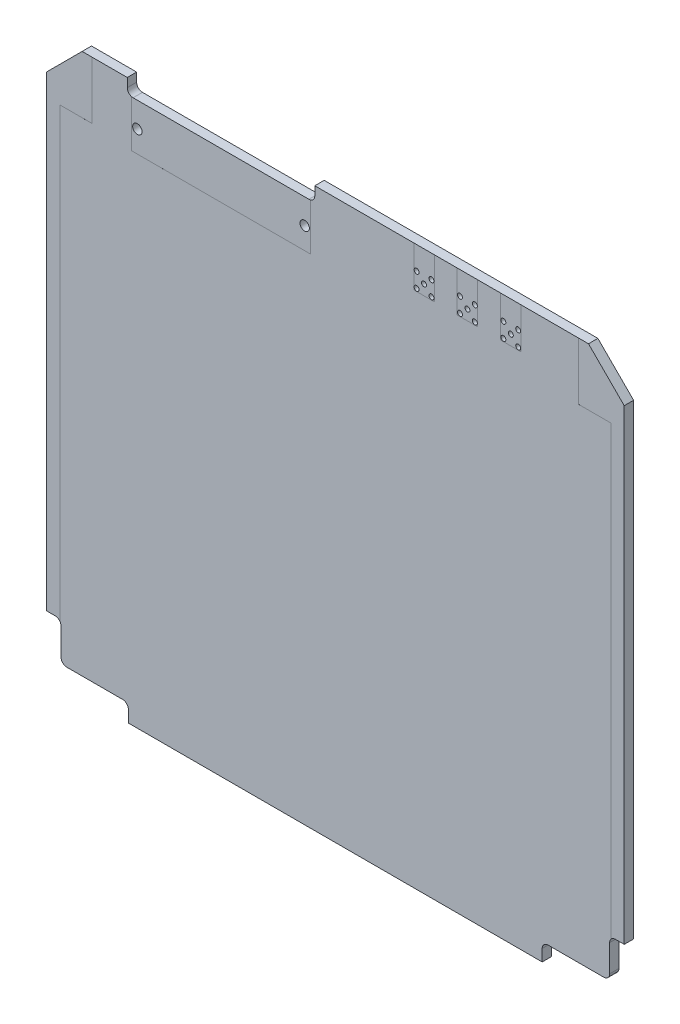
from build123d import *

# Parameters (mm, degrees)
SKETCH1_R           = 0.425
SKETCH1_R_2         = 0.8
BOSS_EXTRUDE1_DEPTH = 1.6
CUT_EXTRUDE1_DEPTH  = 0.0001
CUT_EXTRUDE2_DEPTH  = 0.0001
PARTFOOTPRINTS_W    = 30.48
PARTFOOTPRINTS_H    = 7.989227112
PARTFOOTPRINTS_W_2  = 3.5
PARTFOOTPRINTS_H_2  = 6.95
CUT_EXTRUDE3_DEPTH  = 0.0001


with BuildPart() as part:
    # Sketch1 → Boss-Extrude1 (new body)
    with BuildSketch(Plane(origin=(0, 0, -0.0125), x_dir=(-1, 0, 0), z_dir=(0, 0, -1))):
        with BuildLine():
            Line((35.3, -50), (35.3, -48))
            ThreePointArc((35.3, -48), (35.592893219, -47.292893219), (36.3, -47))
            Line((36.3, -47), (45.8, -47))
            ThreePointArc((45.8, -47), (46.507106781, -46.707106781), (46.8, -46))
            Line((46.8, -46), (46.8, -41.4))
            ThreePointArc((46.8, -41.4), (47.092893219, -40.692893219), (47.8, -40.4))
            Line((47.8, -40.4), (49.3, -40.4))
            Line((49.3, -40.4), (49.3, 39.2))
            Line((49.3, 39.2), (43.2, 45.3))
            Line((43.2, 45.3), (35.500000002, 45.3))
            Line((35.500000002, 45.3), (35.500000002, 43.8))
            ThreePointArc((35.500000002, 43.8), (35.207106783, 43.092893219), (34.500000002, 42.8))
            Line((34.500000002, 42.8), (4.499999998, 42.8))
            ThreePointArc((4.499999998, 42.8), (3.792893217, 43.092893219), (3.499999998, 43.8))
            Line((3.499999998, 43.8), (3.499999998, 45.3))
            Line((3.499999998, 45.3), (-43.2, 45.3))
            Line((-43.2, 45.3), (-49.3, 39.2))
            Line((-49.3, 39.2), (-49.3, -40.4))
            Line((-49.3, -40.4), (-47.8, -40.4))
            ThreePointArc((-47.8, -40.4), (-47.092893219, -40.692893219), (-46.8, -41.4))
            Line((-46.8, -41.4), (-46.8, -46))
            ThreePointArc((-46.8, -46), (-46.507106781, -46.707106781), (-45.8, -47))
            Line((-45.8, -47), (-36.3, -47))
            ThreePointArc((-36.3, -47), (-35.592893219, -47.292893219), (-35.3, -48))
            Line((-35.3, -48), (-35.3, -50))
            Line((-35.3, -50), (35.3, -50))
        make_face()
        with Locations((-21.27, 41.37)):
            Circle(SKETCH1_R, mode=Mode.SUBTRACT)
        with Locations((-23.81, 41.37)):
            Circle(SKETCH1_R, mode=Mode.SUBTRACT)
        with Locations((-22.54, 40.1)):
            Circle(SKETCH1_R, mode=Mode.SUBTRACT)
        with Locations((-13.87, 41.37)):
            Circle(SKETCH1_R, mode=Mode.SUBTRACT)
        with Locations((-23.81, 38.83)):
            Circle(SKETCH1_R, mode=Mode.SUBTRACT)
        with Locations((-16.41, 41.37)):
            Circle(SKETCH1_R, mode=Mode.SUBTRACT)
        with Locations((-15.14, 40.1)):
            Circle(SKETCH1_R, mode=Mode.SUBTRACT)
        with Locations((-21.27, 38.83)):
            Circle(SKETCH1_R, mode=Mode.SUBTRACT)
        with Locations((-28.67, 41.37)):
            Circle(SKETCH1_R, mode=Mode.SUBTRACT)
        with Locations((-31.21, 41.37)):
            Circle(SKETCH1_R, mode=Mode.SUBTRACT)
        with Locations((-16.41, 38.83)):
            Circle(SKETCH1_R, mode=Mode.SUBTRACT)
        with Locations((-29.94, 40.1)):
            Circle(SKETCH1_R, mode=Mode.SUBTRACT)
        with Locations((-31.21, 38.83)):
            Circle(SKETCH1_R, mode=Mode.SUBTRACT)
        with Locations((-28.67, 38.83)):
            Circle(SKETCH1_R, mode=Mode.SUBTRACT)
        with Locations((33.775, 38.54)):
            Circle(SKETCH1_R_2, mode=Mode.SUBTRACT)
        with Locations((5.225, 38.54)):
            Circle(SKETCH1_R_2, mode=Mode.SUBTRACT)
        with Locations((-13.87, 38.83)):
            Circle(SKETCH1_R, mode=Mode.SUBTRACT)
    extrude(amount=-BOSS_EXTRUDE1_DEPTH)

    # thermalContacts_lower → Cut-Extrude1 (cut)
    with BuildSketch(Plane(origin=(0, 0, -0.0125), x_dir=(-1, 0, 0), z_dir=(0, 0, -1))):
        Polygon((47, 35.5), (47, -41.5), (59.827263463, -41.5), (59.827263463, 47), (41.5, 47), (41.5, 41.5), (41.5, 35.5), align=None)
        Polygon((-47, 35.5), (-47, -41.5), (-56.192158269, -41.5), (-56.192158269, 47), (-41.5, 47), (-41.5, 41.5), (-41.5, 35.5), align=None)
    extrude(amount=-CUT_EXTRUDE1_DEPTH, mode=Mode.SUBTRACT)

    # thermalContacts_upper → Cut-Extrude2 (cut)
    with BuildSketch(Plane.XY.offset(1.5875)):
        Polygon((-47, 35.5), (-47, -41.5), (-56.192158269, -41.5), (-56.192158269, 47), (-41.5, 47), (-41.5, 41.5), (-41.5, 35.5), align=None)
        Polygon((47, 35.5), (47, -41.5), (59.827263463, -41.5), (59.827263463, 47), (41.5, 47), (41.5, 41.5), (41.5, 35.5), align=None)
    extrude(amount=-CUT_EXTRUDE2_DEPTH, mode=Mode.SUBTRACT)

    # partFootprints → Cut-Extrude3 (cut)
    with BuildSketch(Plane.XY.offset(1.5875)):
        with Locations((-19.5, 38.834613556)):
            Rectangle(PARTFOOTPRINTS_W, PARTFOOTPRINTS_H)
        with Locations((15.14, 41.825)):
            Rectangle(PARTFOOTPRINTS_W_2, PARTFOOTPRINTS_H_2)
        with Locations((22.54, 41.825)):
            Rectangle(PARTFOOTPRINTS_W_2, PARTFOOTPRINTS_H_2)
        with Locations((29.94, 41.825)):
            Rectangle(PARTFOOTPRINTS_W_2, PARTFOOTPRINTS_H_2)
    extrude(amount=-CUT_EXTRUDE3_DEPTH, mode=Mode.SUBTRACT)


solid = part.part
